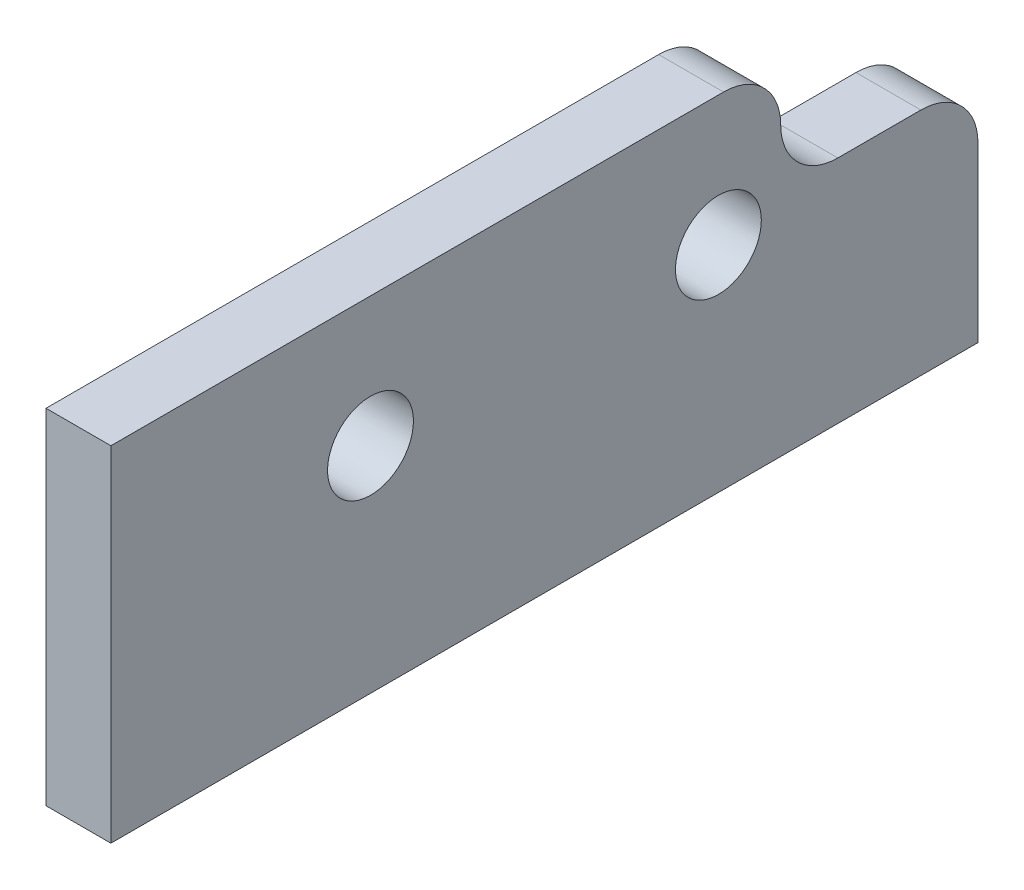
from build123d import *

# Parameters (mm, degrees)
SKETCH1_W           = 42.418
SKETCH1_H           = 16.8402
BOSS_EXTRUDE1_DEPTH = 3.175
SKETCH3_R           = 2.1
CUT_EXTRUDE1_DEPTH  = 24.039105669
SKETCH4_W           = 9.652
SKETCH4_H           = 5.588
CUT_EXTRUDE2_DEPTH  = 24.039105669
FILLET1_R           = 2.794


with BuildPart() as part:
    # Sketch1 → Boss-Extrude1 (new body)
    with BuildSketch(Plane(origin=(0, 0, 0), x_dir=(0, 0, -1), z_dir=(1, 0, 0))):
        Rectangle(SKETCH1_W, SKETCH1_H)
    extrude(amount=BOSS_EXTRUDE1_DEPTH)

    # Sketch3 → Cut-Extrude1 (cut, through all)
    with BuildSketch(Plane(origin=(3.175, 0, 0), x_dir=(0, 0, -1), z_dir=(1, 0, 0))):
        with Locations((-8.509, 2.0701)):
            Circle(SKETCH3_R)
        with Locations((8.509, 2.0701)):
            Circle(SKETCH3_R)
    extrude(amount=-CUT_EXTRUDE1_DEPTH, mode=Mode.SUBTRACT)

    # Sketch4 → Cut-Extrude2 (cut, through all)
    with BuildSketch(Plane(origin=(3.175, 0, 0), x_dir=(0, 0, -1), z_dir=(1, 0, 0))):
        with Locations((16.383, 5.6261)):
            Rectangle(SKETCH4_W, SKETCH4_H)
    extrude(amount=-CUT_EXTRUDE2_DEPTH, mode=Mode.SUBTRACT)

    # Fillet1
    fillet1_edges = [part.edges().sort_by_distance(p)[0] for p in [
        (1.5875, 2.8321, -21.209),
        (1.5875, 8.4201, -11.557),
        (1.5875, 2.8321, -11.557),
    ]]
    fillet(fillet1_edges, radius=FILLET1_R - 0.0001)  # a hair under: the kernel refuses the full size


solid = part.part
